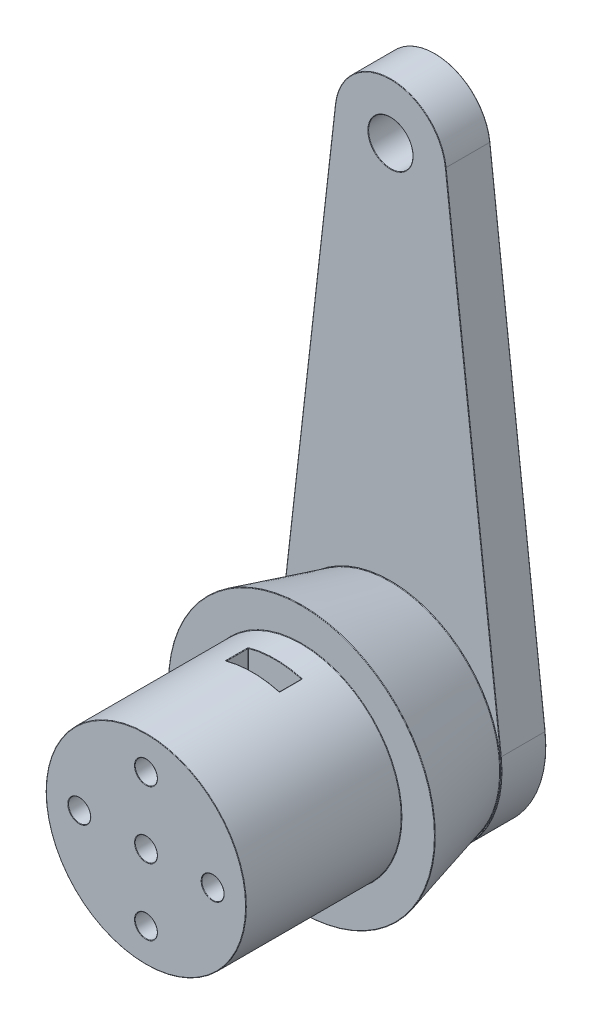
from build123d import *

# Parameters (mm, degrees)
SKETCH1_R               = 22.5
BOSS_EXTRUDE1_DEPTH     = 35
SKETCH2_R               = 30
BOSS_EXTRUDE2_DEPTH     = 20
BOSS_EXTRUDE2_TAPER     = 15
SKETCH3_R               = 5
BOSS_EXTRUDE3_DEPTH     = 10
CUT_EXTRUDE2_DEPTH      = 142.884636258
CUT_EXTRUDE2_DEPTH_BACK = 60
SKETCH5_R               = 5
SKETCH6_R               = 2.5
CUT_EXTRUDE3_DEPTH      = 60
SKETCH7_W               = 12
SKETCH7_H               = 5
CUT_EXTRUDE4_DEPTH      = 27
SKETCH9_R               = 2.5
CUT_EXTRUDE5_DEPTH      = 13
FILLET2_R               = 0.1


with BuildPart() as part:
    # Sketch1 → Boss-Extrude1 (new body)
    with BuildSketch(Plane.XY):
        Circle(SKETCH1_R)
    extrude(amount=BOSS_EXTRUDE1_DEPTH)

    # Sketch2 → Boss-Extrude2 (add)
    with BuildSketch(Plane(origin=(0, 0, 0), x_dir=(-1, 0, 0), z_dir=(0, 0, -1))):
        Circle(SKETCH2_R)
    extrude(amount=BOSS_EXTRUDE2_DEPTH, taper=BOSS_EXTRUDE2_TAPER)

    # Sketch3 → Boss-Extrude3 (add)
    with BuildSketch(Plane(origin=(0, 0, -20), x_dir=(-1, 0, 0), z_dir=(0, 0, -1))):
        with BuildLine():
            Line((-12.41903011, 111.420454545), (-24.838060221, 2.840909091))
            ThreePointArc((-24.838060221, 2.840909091), (0, -25), (24.838060221, 2.840909091))
            Line((24.838060221, 2.840909091), (12.41903011, 111.420454545))
            ThreePointArc((12.41903011, 111.420454545), (0, 122.5), (-12.41903011, 111.420454545))
        make_face()
        Circle(SKETCH3_R, mode=Mode.SUBTRACT)
        with Locations((0, 110)):
            Circle(SKETCH3_R, mode=Mode.SUBTRACT)
    extrude(amount=BOSS_EXTRUDE3_DEPTH)

    # Sketch5 → Cut-Extrude2 (cut, two sides: drawn at the far end of the back side and taken through both)
    with BuildSketch(Plane(origin=(0, 0, -30), x_dir=(-1, 0, 0), z_dir=(0, 0, -1)).offset(-CUT_EXTRUDE2_DEPTH_BACK)):
        Circle(SKETCH5_R)
    extrude(amount=CUT_EXTRUDE2_DEPTH + CUT_EXTRUDE2_DEPTH_BACK, mode=Mode.SUBTRACT)

    # Sketch6 → Cut-Extrude3 (cut)
    with BuildSketch(Plane(origin=(0, 0, 30), x_dir=(-1, 0, 0), z_dir=(0, 0, -1))):
        Circle(SKETCH6_R)
    extrude(amount=-CUT_EXTRUDE3_DEPTH, mode=Mode.SUBTRACT)

    # Sketch7 → Cut-Extrude4 (cut)
    with BuildSketch(Plane(origin=(0, 22.5, 0), x_dir=(1, 0, 0), z_dir=(0, 1, 0))):
        with Locations((0, -8.5)):
            Rectangle(SKETCH7_W, SKETCH7_H)
    extrude(amount=-CUT_EXTRUDE4_DEPTH, mode=Mode.SUBTRACT)

    # Sketch9 → Cut-Extrude5 (cut)
    with BuildSketch(Plane.XY.offset(35)):
        with Locations((0, 15)):
            Circle(SKETCH9_R)
        with Locations((15, 0)):
            Circle(SKETCH9_R)
        with Locations((0, -15)):
            Circle(SKETCH9_R)
        with Locations((-15, 0)):
            Circle(SKETCH9_R)
    extrude(amount=-CUT_EXTRUDE5_DEPTH, mode=Mode.SUBTRACT)

    # Fillet2
    fillet2_edges = [part.edges().sort_by_distance(p)[0] for p in [
        (5, 0, 30),
        (-6, 8.592624221, 11),
        (-6, -4.5, 8.5),
        (6, 8.592624221, 6),
        (6, 8.592624221, 11),
        (-6, 8.592624221, 6),
        (4.089724736, -4.5, 6),
        (6, -4.5, 8.5),
        (-4.089724736, -4.5, 6),
        (-22.5, 0, 0),
        (24.641016151, 0, -20),
    ]]
    fillet(fillet2_edges, radius=FILLET2_R)
    fillet2_2_edges = [part.edges().sort_by_distance(p)[0] for p in [
        (0, -25, -30),
        (-18.628545166, 57.130681818, -30),
        (0, 122.5, -30),
        (18.628545166, 57.130681818, -30),
        (5, 110, -20),
        (0, -25, -20),
        (-18.628545166, 57.130681818, -20),
        (0, 122.5, -20),
        (18.628545166, 57.130681818, -20),
        (5, 0, -30),
        (5, 110, -30),
        (2.5, 0, 35),
        (-2.179449472, -4.5, 8.55),
        (2.655442773, 4.236581603, 11),
        (2.179449472, -4.5, 8.55),
        (-6, 21.685248442, 8.5),
        (6, 21.685248442, 8.5),
        (-22.5, 0, 35),
        (30, 0, 0),
        (-2.5, 15, 35),
        (12.5, 0, 35),
        (-2.5, -15, 35),
        (-17.5, 0, 35),
        (-4.236581603, -2.655442773, 11),
        (5.97078425, 21.693310846, 10.970637031),
        (5.97078425, 21.693310846, 6.029362969),
        (-5.970784249, 21.693310846, 10.970637032),
        (-5.97078425, 21.693310846, 6.029362969),
        (2.239973844, -4.470180888, 6.028763473),
        (-2.239973844, -4.470180888, 6.028763473),
    ]]
    fillet(fillet2_2_edges, radius=FILLET2_R)


solid = part.part
